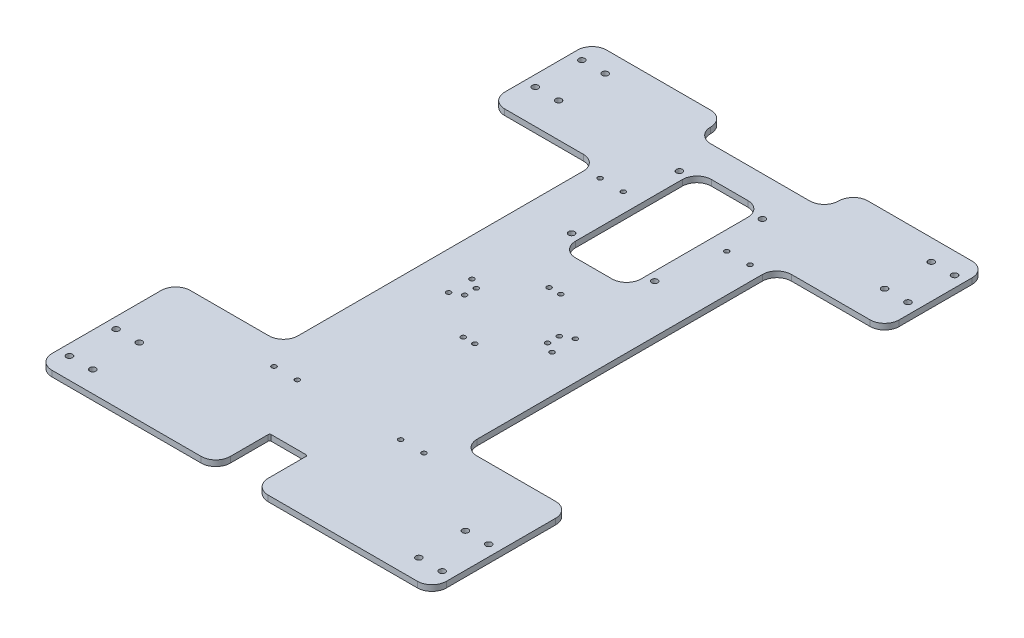
from build123d import *

# Parameters (mm, degrees)
SKETCH_1_W           = 271
SKETCH_1_H           = 381
EXTRUDE_2_DEPTH      = 4
SKETCH_4_R           = 2.1
CUT_EXTRUDE_3_DEPTH  = 4
SKETCH_5_W           = 26
SKETCH_5_H           = 74.1
CUT_EXTRUDE_4_DEPTH  = 4
SKETCH_6_W           = 148
SKETCH_6_H           = 216
CUT_EXTRUDE_6_DEPTH  = 4
SKETCH_7_R           = 1.6
CUT_EXTRUDE_7_DEPTH  = 4
SKETCH_8_R           = 1.6
CUT_EXTRUDE_8_DEPTH  = 4
SKETCH_9_W           = 45
SKETCH_9_H           = 93.3
CUT_EXTRUDE_9_DEPTH  = 4
SKETCH_10_R          = 2.1
CUT_EXTRUDE_10_DEPTH = 4
SKETCH_11_R          = 1.6
CUT_EXTRUDE_11_DEPTH = 4
SKETCH_12_R          = 2.1
CUT_EXTRUDE_12_DEPTH = 4
SKETCH_13_W          = 88
SKETCH_13_H          = 40
CUT_EXTRUDE_13_DEPTH = 4
FILLET_3_R           = 10
FILLET_5_R           = 10
FILLET_6_R           = 1
SKETCH_15_R          = 1.6
CUT_EXTRUDE_17_DEPTH = 10


with BuildPart() as part:
    # 草图1 → 凸台-拉伸2 (new body)
    with BuildSketch(Plane(origin=(0, 0, 0), x_dir=(1, 0, 0), z_dir=(0, 1, 0))):
        Rectangle(SKETCH_1_W, SKETCH_1_H)
    extrude(amount=EXTRUDE_2_DEPTH)

    # 草图4 → 切除-拉伸3 (cut)
    with BuildSketch(Plane(origin=(0, 4, 0), x_dir=(1, 0, 0), z_dir=(0, 1, 0))):
        with Locations(Location((-128, -176, 0), (0, 0, 270))):
            Circle(SKETCH_4_R)
        with Locations(Location((-128, -144, 0), (0, 0, 270))):
            Circle(SKETCH_4_R)
        with Locations(Location((-112, -144, 0), (0, 0, 270))):
            Circle(SKETCH_4_R)
        with Locations(Location((-112, -176, 0), (0, 0, 270))):
            Circle(SKETCH_4_R)
        with Locations(Location((112, -144, 0), (0, 0, 90))):
            Circle(SKETCH_4_R)
        with Locations(Location((128, -144, 0), (0, 0, 90))):
            Circle(SKETCH_4_R)
        with Locations(Location((128, -176, 0), (0, 0, 90))):
            Circle(SKETCH_4_R)
        with Locations(Location((112, -176, 0), (0, 0, 90))):
            Circle(SKETCH_4_R)
        with Locations(Location((112, 176, 0), (0, 0, 270))):
            Circle(SKETCH_4_R)
        with Locations(Location((128, 176, 0), (0, 0, 270))):
            Circle(SKETCH_4_R)
        with Locations(Location((128, 144, 0), (0, 0, 270))):
            Circle(SKETCH_4_R)
        with Locations(Location((112, 144, 0), (0, 0, 270))):
            Circle(SKETCH_4_R)
        with Locations(Location((-112, 176, 0), (0, 0, 90))):
            Circle(SKETCH_4_R)
        with Locations(Location((-112, 144, 0), (0, 0, 90))):
            Circle(SKETCH_4_R)
        with Locations(Location((-128, 144, 0), (0, 0, 90))):
            Circle(SKETCH_4_R)
        with Locations(Location((-128, 176, 0), (0, 0, 90))):
            Circle(SKETCH_4_R)
    extrude(amount=-CUT_EXTRUDE_3_DEPTH, mode=Mode.SUBTRACT)

    # 草图5 → 切除-拉伸4 (cut)
    with BuildSketch(Plane(origin=(0, 4, 0), x_dir=(1, 0, 0), z_dir=(0, 1, 0))):
        with Locations((0, -190.5)):
            Rectangle(SKETCH_5_W, SKETCH_5_H)
    extrude(amount=-CUT_EXTRUDE_4_DEPTH, mode=Mode.SUBTRACT)

    # 草图6 → 切除-拉伸6 (cut)
    with BuildSketch(Plane(origin=(0, 4, 0), x_dir=(1, 0, 0), z_dir=(0, 1, 0))):
        with Locations((135.5, 12.5)):
            Rectangle(SKETCH_6_W, SKETCH_6_H)
        with Locations((-135.5, 12.5)):
            Rectangle(SKETCH_6_W, SKETCH_6_H)
    extrude(amount=-CUT_EXTRUDE_6_DEPTH, mode=Mode.SUBTRACT)

    # 草图7 → 切除-拉伸7 (cut)
    with BuildSketch(Plane(origin=(0, 4, 0), x_dir=(1, 0, 0), z_dir=(0, 1, 0))):
        with Locations(Location((-51.5, -112, 0), (0, 0, 270))):
            Circle(SKETCH_7_R)
        with Locations(Location((-35.5, -112, 0), (0, 0, 270))):
            Circle(SKETCH_7_R)
        with Locations(Location((35.5, -112, 0), (0, 0, 90))):
            Circle(SKETCH_7_R)
        with Locations(Location((51.5, -112, 0), (0, 0, 90))):
            Circle(SKETCH_7_R)
    extrude(amount=-CUT_EXTRUDE_7_DEPTH, mode=Mode.SUBTRACT)

    # 草图8 → 切除-拉伸8 (cut)
    with BuildSketch(Plane(origin=(0, 4, 0), x_dir=(1, 0, 0), z_dir=(0, 1, 0))):
        with Locations(Location((-35.5, 8, 0), (0, 0, 270))):
            Circle(SKETCH_8_R)
        with Locations(Location((-35.5, -8, 0), (0, 0, 270))):
            Circle(SKETCH_8_R)
        with Locations(Location((35.5, -8, 0), (0, 0, 90))):
            Circle(SKETCH_8_R)
        with Locations(Location((35.5, 8, 0), (0, 0, 90))):
            Circle(SKETCH_8_R)
    extrude(amount=-CUT_EXTRUDE_8_DEPTH, mode=Mode.SUBTRACT)

    # 草图9 → 切除-拉伸9 (cut)
    with BuildSketch(Plane(origin=(0, 4, 0), x_dir=(1, 0, 0), z_dir=(0, 1, 0))):
        with Locations((0, 102.85)):
            Rectangle(SKETCH_9_W, SKETCH_9_H)
    extrude(amount=-CUT_EXTRUDE_9_DEPTH, mode=Mode.SUBTRACT)

    # 草图10 → 切除-拉伸10 (cut)
    with BuildSketch(Plane(origin=(0, 4, 0), x_dir=(1, 0, 0), z_dir=(0, 1, 0))):
        with Locations(Location((-28.5, 69.5, 0), (0, 0, 270))):
            Circle(SKETCH_10_R)
        with Locations(Location((28.5, 69.5, 0), (0, 0, 90))):
            Circle(SKETCH_10_R)
    extrude(amount=-CUT_EXTRUDE_10_DEPTH, mode=Mode.SUBTRACT)

    # 草图11 → 切除-拉伸11 (cut)
    with BuildSketch(Plane(origin=(0, 4, 0), x_dir=(1, 0, 0), z_dir=(0, 1, 0))):
        with Locations(Location((-51.5, 112, 0), (0, 0, 270))):
            Circle(SKETCH_11_R)
        with Locations(Location((-35.5, 112, 0), (0, 0, 270))):
            Circle(SKETCH_11_R)
        with Locations(Location((35.5, 112, 0), (0, 0, 90))):
            Circle(SKETCH_11_R)
        with Locations(Location((51.5, 112, 0), (0, 0, 90))):
            Circle(SKETCH_11_R)
    extrude(amount=-CUT_EXTRUDE_11_DEPTH, mode=Mode.SUBTRACT)

    # 草图12 → 切除-拉伸12 (cut)
    with BuildSketch(Plane(origin=(0, 4, 0), x_dir=(1, 0, 0), z_dir=(0, 1, 0))):
        with Locations(Location((-28.5, 143.5, 0), (0, 0, 270))):
            Circle(SKETCH_12_R)
        with Locations(Location((28.5, 143.5, 0), (0, 0, 90))):
            Circle(SKETCH_12_R)
    extrude(amount=-CUT_EXTRUDE_12_DEPTH, mode=Mode.SUBTRACT)

    # 草图13 → 切除-拉伸13 (cut)
    with BuildSketch(Plane(origin=(0, 4, 0), x_dir=(1, 0, 0), z_dir=(0, 1, 0))):
        with Locations((0, 190.5)):
            Rectangle(SKETCH_13_W, SKETCH_13_H)
    extrude(amount=-CUT_EXTRUDE_13_DEPTH, mode=Mode.SUBTRACT)

    # 圆角3
    fillet_3_edges = [part.edges().sort_by_distance(p)[0] for p in [
        (22.5, 2, -149.5),
        (22.5, 2, -56.2),
        (-22.5, 2, -56.2),
        (-22.5, 2, -149.5),
    ]]
    fillet(fillet_3_edges, radius=FILLET_3_R)

    # 圆角5
    fillet_5_edges = [part.edges().sort_by_distance(p)[0] for p in [
        (-44, 2, -170.5),
        (-44, 2, -190.5),
        (-135.5, 2, -190.5),
        (-135.5, 2, -120.5),
        (-61.5, 2, -120.5),
        (-61.5, 2, 95.5),
        (-135.5, 2, 95.5),
        (-135.5, 2, 190.5),
        (-13, 2, 190.5),
        (13, 2, 190.5),
        (135.5, 2, 190.5),
        (135.5, 2, 95.5),
        (61.5, 2, 95.5),
        (61.5, 2, -120.5),
        (135.5, 2, -120.5),
        (135.5, 2, -190.5),
        (44, 2, -190.5),
        (44, 2, -170.5),
    ]]
    fillet(fillet_5_edges, radius=FILLET_5_R - 0.0001)  # a hair under: the kernel refuses the full size

    # 圆角6
    fillet_6_edges = [part.edges().sort_by_distance(p)[0] for p in [
        (13, 2, 153.45),
        (-13, 2, 153.45),
    ]]
    fillet(fillet_6_edges, radius=FILLET_6_R)

    # 草图15 → 切除-拉伸17 (cut)
    with BuildSketch(Plane(origin=(0, 4, 0), x_dir=(1, 0, 0), z_dir=(0, 1, 0))):
        with Locations(Location((-28.5, -4, 0), (0, 0, 270))):
            Circle(SKETCH_15_R)
        with Locations(Location((-28.5, 4, 0), (0, 0, 270))):
            Circle(SKETCH_15_R)
        with Locations(Location((-4, 29.5, 0), (0, 0, 270))):
            Circle(SKETCH_15_R)
        with Locations(Location((28.5, 4, 0), (0, 0, 270))):
            Circle(SKETCH_15_R)
        with Locations(Location((28.5, -4, 0), (0, 0, 270))):
            Circle(SKETCH_15_R)
        with Locations(Location((4, 29.5, 0), (0, 0, 270))):
            Circle(SKETCH_15_R)
        with Locations(Location((4, -29.5, 0), (0, 0, 270))):
            Circle(SKETCH_15_R)
        with Locations(Location((-4, -29.5, 0), (0, 0, 270))):
            Circle(SKETCH_15_R)
    extrude(amount=-CUT_EXTRUDE_17_DEPTH, mode=Mode.SUBTRACT)


solid = part.part
